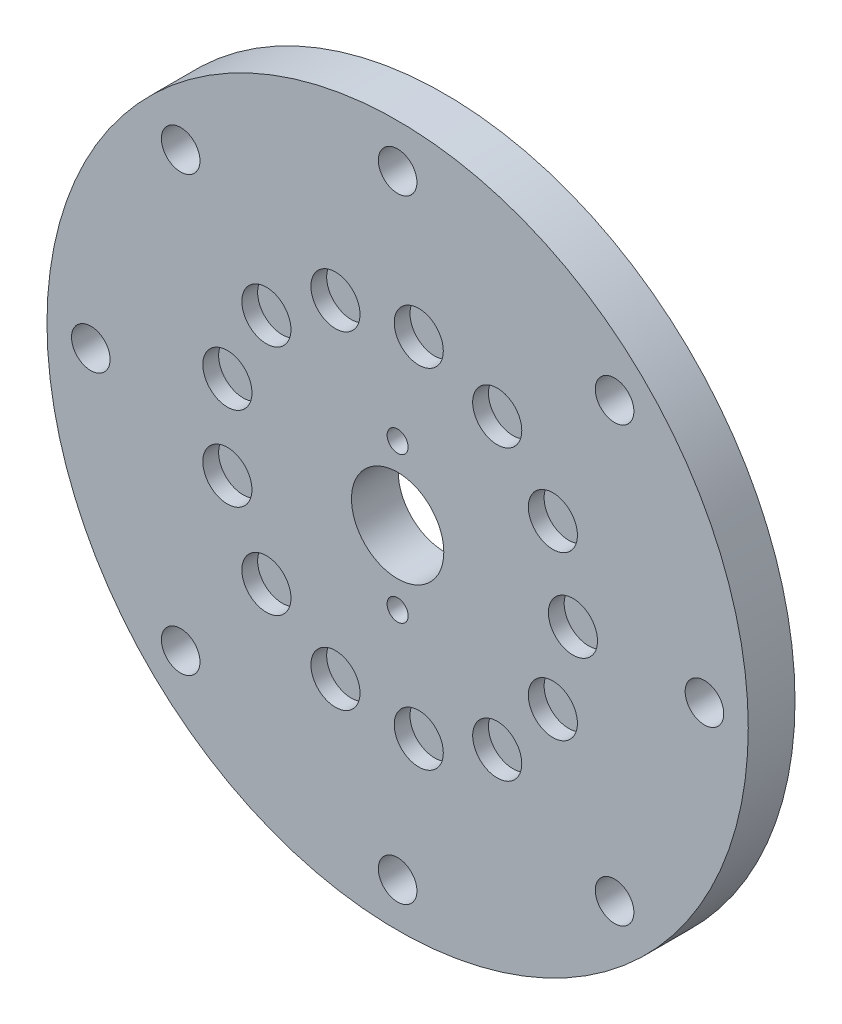
from build123d import *

# Parameters (mm, degrees)
SKETCH1_R            = 60
SKETCH1_R_2          = 7.9
BOSS_EXTRUDE1_DEPTH  = 8
M6_CLEARANCE_HOLE1_D = 6.6
M3_CLEARANCE_HOLE1_D = 3.6
SKETCH8_R            = 4.2
CUT_EXTRUDE1_DEPTH   = 2.7


with BuildPart() as part:
    # Sketch1 → Boss-Extrude1 (new body)
    with BuildSketch(Plane.XY):
        Circle(SKETCH1_R)
        Circle(SKETCH1_R_2, mode=Mode.SUBTRACT)
    extrude(amount=BOSS_EXTRUDE1_DEPTH)

    # M6 Clearance Hole1 (through all)
    with Locations(Plane.XY.offset(8)):
        with Locations((-37.123106012, 37.123106012), (0, 52.5), (37.123106012, 37.123106012), (52.5, 0), (37.123106012, -37.123106012), (0, -52.5), (-37.123106012, -37.123106012), (-52.5, 0)):
            Hole(M6_CLEARANCE_HOLE1_D / 2)

    # M3 Clearance Hole1 (through all)
    with Locations(Plane.XY.offset(8)):
        with Locations((0, 12.5), (0, -12.5), (0, 0)):
            Hole(M3_CLEARANCE_HOLE1_D / 2)

    # Sketch8 → Cut-Extrude1 (cut)
    with BuildSketch(Plane.XY.offset(8)):
        with Locations((30, 0)):
            Circle(SKETCH8_R)
        with Locations((26.56368077, -13.941695161)):
            Circle(SKETCH8_R)
        with Locations((17.041942402, -24.689515977)):
            Circle(SKETCH8_R)
        with Locations((3.616100408, -29.781266223)):
            Circle(SKETCH8_R)
        with Locations((-10.638146611, -28.050487281)):
            Circle(SKETCH8_R)
        with Locations((-22.455322445, -19.893679747)):
            Circle(SKETCH8_R)
        with Locations((-29.128254523, -7.179469929)):
            Circle(SKETCH8_R)
        with Locations((-29.128254523, 7.179469929)):
            Circle(SKETCH8_R)
        with Locations((-22.455322445, 19.893679747)):
            Circle(SKETCH8_R)
        with Locations((-10.638146611, 28.050487281)):
            Circle(SKETCH8_R)
        with Locations((3.616100408, 29.781266223)):
            Circle(SKETCH8_R)
        with Locations((17.041942402, 24.689515977)):
            Circle(SKETCH8_R)
        with Locations((26.56368077, 13.941695161)):
            Circle(SKETCH8_R)
    extrude(amount=-CUT_EXTRUDE1_DEPTH, mode=Mode.SUBTRACT)


solid = part.part
